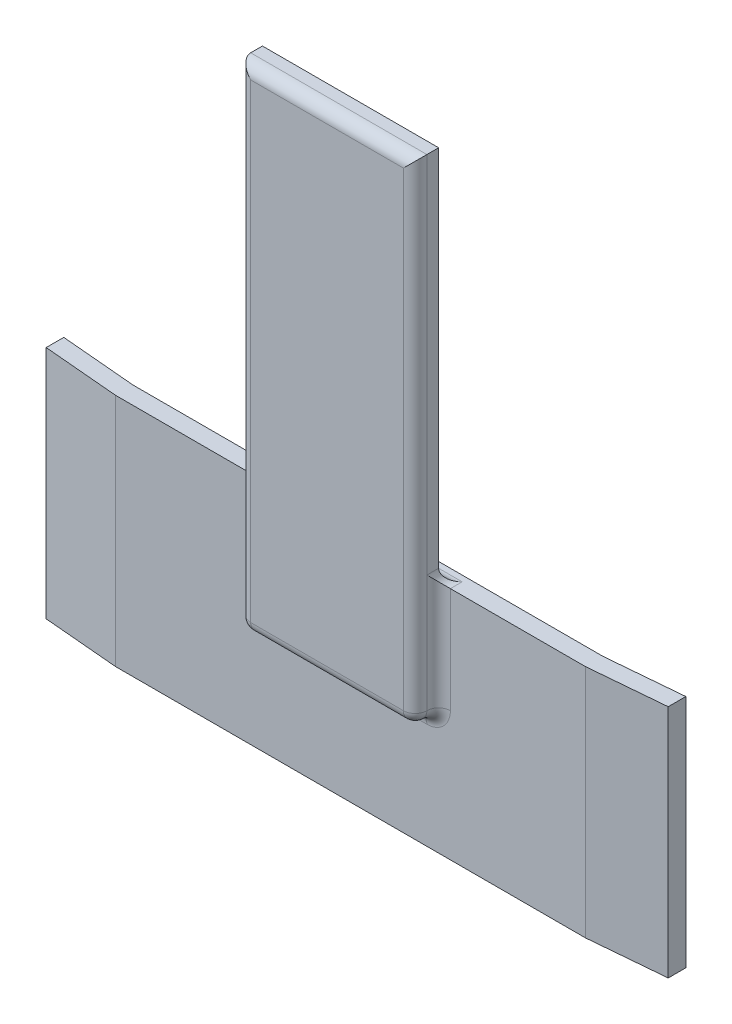
from build123d import *

# Parameters (mm, degrees)
SKETCH1_W           = 101.6
SKETCH1_H           = 50.8
BOSS_EXTRUDE2_DEPTH = 3.8099999999999996
SKETCH2_W           = 50.8
SKETCH2_H           = 16.50999999999999
BOSS_EXTRUDE4_DEPTH = 3.8099999999999996
BOSS_EXTRUDE5_DEPTH = 5.08
FILLET1_R           = 2.54
FILLET18_R          = 2.54
FILLET19_R          = 2.54
FILLET20_R          = 2.54


with BuildPart() as part:
    # Sketch1 → Boss-Extrude2 (new body)
    with BuildSketch(Plane.XY):
        Rectangle(SKETCH1_W, SKETCH1_H)
    extrude(amount=BOSS_EXTRUDE2_DEPTH)

    # Sketch2 → Boss-Extrude4 (add, along a direction that is not the sketch's normal)
    with BuildSketch(Plane(origin=(0.71668285194542, 0, 8.191722482228297), x_dir=(0, 1, 0), z_dir=(-0.08715574274765836, 0, -0.9961946980917455))):
        with Locations((-3.55e-15, 58.52962728319207)):
            Rectangle(SKETCH2_W, SKETCH2_H)
    boss_extrude4 = extrude(amount=BOSS_EXTRUDE4_DEPTH, dir=(0, 0, -1))

    # Mirror1: Boss-Extrude4 across plane
    add(boss_extrude4.mirror(Plane.ZY))

    # Sketch4 → Boss-Extrude5 (add)
    with BuildSketch(Plane.XY.offset(3.8099999999999996)):
        Polygon((-19.05, 0), (19.05, 7e-15), (19.049999999999972, 106.68), (-19.050000000000015, 106.67999999999999), align=None)
    extrude(amount=BOSS_EXTRUDE5_DEPTH)

    # Fillet1
    fillet1_edges = [part.edges().sort_by_distance(p)[0] for p in [
        (-19.05, 12.700000000000003, 3.8099999999999996),
        (0, 3.5e-15, 3.8099999999999996),
        (-19.05, 0, 6.35),
        (19.049999999999997, 12.700000000000001, 3.8099999999999996),
        (19.05, 7e-15, 6.35),
        (-2.132e-14, 106.68, 8.89),
        (-19.050000000000008, 53.339999999999996, 8.89),
        (0, 3.5e-15, 8.89),
        (19.049999999999986, 53.34000000000001, 8.89),
    ]]
    fillet(fillet1_edges, radius=FILLET1_R - 0.0001)  # a hair under: the kernel refuses the full size

    # Fillet18
    fillet18_edges = [part.edges().sort_by_distance(p)[0] for p in [
        (-7.11e-15, 25.399999999999995, 3.8099999999999996),
    ]]
    fillet(fillet18_edges, radius=FILLET18_R)

    # Fillet19
    fillet19_edges = [part.edges().sort_by_distance(p)[0] for p in [
        (19.049999999999994, 25.399999999999995, 3.8099499999999993),
    ]]
    fillet(fillet19_edges, radius=FILLET19_R - 0.0001)  # a hair under: the kernel refuses the full size

    # Fillet20
    fillet20_edges = [part.edges().sort_by_distance(p)[0] for p in [
        (-19.050000000000004, 25.399999999999995, 3.8099499999999997),
    ]]
    fillet(fillet20_edges, radius=FILLET20_R - 0.0001)  # a hair under: the kernel refuses the full size


solid = part.part
